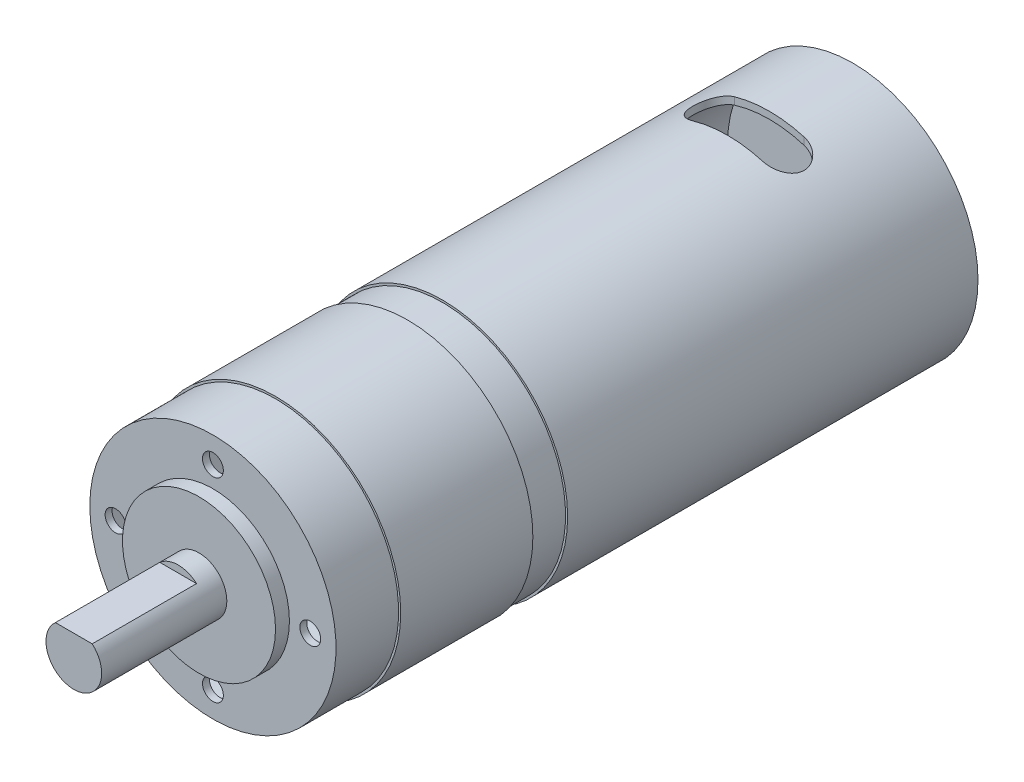
from build123d import *

# Parameters (mm, degrees)
SKETCH_1_R          = 18
EXTRUDE_1_DEPTH     = 92
CUT_EXTRUDE_2_DEPTH = 36
SHELL_8_T           = -1
SKETCH_2_R          = 11
EXTRUDE_2_DEPTH     = 2
SKETCH_3_R          = 4
EXTRUDE_3_DEPTH     = 18
CUT_EXTRUDE_START   = -15
CUT_EXTRUDE_1_DEPTH = 15
SKETCH_5_R          = 5
EXTRUDE_4_DEPTH     = 3
SKETCH_6_R          = 1.5
EXTRUDE_5_DEPTH     = 1
FILLET_1_R          = 1
SKETCH_8_R          = 1.5
CUT_EXTRUDE_3_DEPTH = 5
SKETCH_9_W          = 0.3
SKETCH_9_H          = 9
SKETCH_9_H_2        = 5


with BuildPart() as part:
    # 草图1 → 凸台-拉伸1 (new body)
    with BuildSketch(Plane.XY):
        Circle(SKETCH_1_R)
    extrude(amount=EXTRUDE_1_DEPTH)

    # 草图7 → 切除-拉伸2 (cut)
    with BuildSketch(Plane(origin=(0, 18, 0), x_dir=(1, 0, 0), z_dir=(0, 1, 0))):
        with BuildLine():
            Line((5, -18), (-5, -18))
            ThreePointArc((-5, -18), (-8, -15), (-5, -12))
            Line((-5, -12), (5, -12))
            ThreePointArc((5, -12), (8, -15), (5, -18))
        make_face()
    extrude(amount=-CUT_EXTRUDE_2_DEPTH, mode=Mode.SUBTRACT)

    # 抽壳8
    shell_8_openings = [part.faces().sort_by_distance(p)[0] for p in [
        (8, 0, 15),
        (0, 0, 18),
        (-8, 0, 15),
        (0, 0, 12),
    ]]
    offset(amount=SHELL_8_T, openings=shell_8_openings)

    # 草图2 → 凸台-拉伸2 (add)
    with BuildSketch(Plane.XY.offset(92)):
        Circle(SKETCH_2_R)
    extrude(amount=EXTRUDE_2_DEPTH)

    # 草图3 → 凸台-拉伸3 (add)
    with BuildSketch(Plane.XY.offset(94)):
        Circle(SKETCH_3_R)
    extrude(amount=EXTRUDE_3_DEPTH)

    # 草图4 → 切除-拉伸1 (cut)
    with BuildSketch(Plane.XY.offset(112).offset(CUT_EXTRUDE_START)):
        with BuildLine():
            ThreePointArc((2.645751311, 3), (1.414213562, 3.741657387), (0, 4))
            Line((0, 4), (0, 3))
            Line((0, 3), (2.645751311, 3))
        make_face()
        with BuildLine():
            Line((0, 3), (0, 4))
            ThreePointArc((0, 4), (-1.414213562, 3.741657387), (-2.645751311, 3))
            Line((-2.645751311, 3), (0, 3))
        make_face()
    extrude(amount=CUT_EXTRUDE_1_DEPTH, mode=Mode.SUBTRACT)

    # 草图5 → 凸台-拉伸4 (add)
    with BuildSketch(Plane(origin=(0, 0, 0), x_dir=(-1, 0, 0), z_dir=(0, 0, -1))):
        with Locations(Location((0, 0, 0), (0, 0, 180))):
            Circle(SKETCH_5_R)
    extrude(amount=EXTRUDE_4_DEPTH)

    # 草图6 → 凸台-拉伸5 (add)
    with BuildSketch(Plane(origin=(0, 0, -3), x_dir=(-1, 0, 0), z_dir=(0, 0, -1))):
        Circle(SKETCH_6_R)
    extrude(amount=EXTRUDE_5_DEPTH)

    # 圆角1
    fillet_1_edges = [part.edges().sort_by_distance(p)[0] for p in [
        (-5, 0, -3),
        (1.5, 0, -4),
    ]]
    fillet(fillet_1_edges, radius=FILLET_1_R - 0.0001)  # a hair under: the kernel refuses the full size

    # 草图8 → 切除-拉伸3 (cut)
    with BuildSketch(Plane.XY.offset(92)):
        with Locations((14, 0)):
            Circle(SKETCH_8_R)
        with Locations((0, -14)):
            Circle(SKETCH_8_R)
        with Locations((-14, 0)):
            Circle(SKETCH_8_R)
        with Locations((0, 14)):
            Circle(SKETCH_8_R)
    extrude(amount=-CUT_EXTRUDE_3_DEPTH, mode=Mode.SUBTRACT)

    # 草图9 → 切除-旋转1 (revolve, cut)
    with BuildSketch(Plane(origin=(0, 0, 0), x_dir=(1, 0, 0), z_dir=(0, 1, 0)), mode=Mode.PRIVATE) as cut_revolve_1_sk:
        with Locations((17.85, -87.5)):
            Rectangle(SKETCH_9_W, SKETCH_9_H)
        with Locations((17.85, -61.5)):
            Rectangle(SKETCH_9_W, SKETCH_9_H_2)
    revolve(cut_revolve_1_sk.sketch.rotate(Axis((0, 0, 0), (0, 0, 1)), 180), axis=Axis((0, 0, 0), (0, 0, 1)), mode=Mode.SUBTRACT)


solid = part.part
